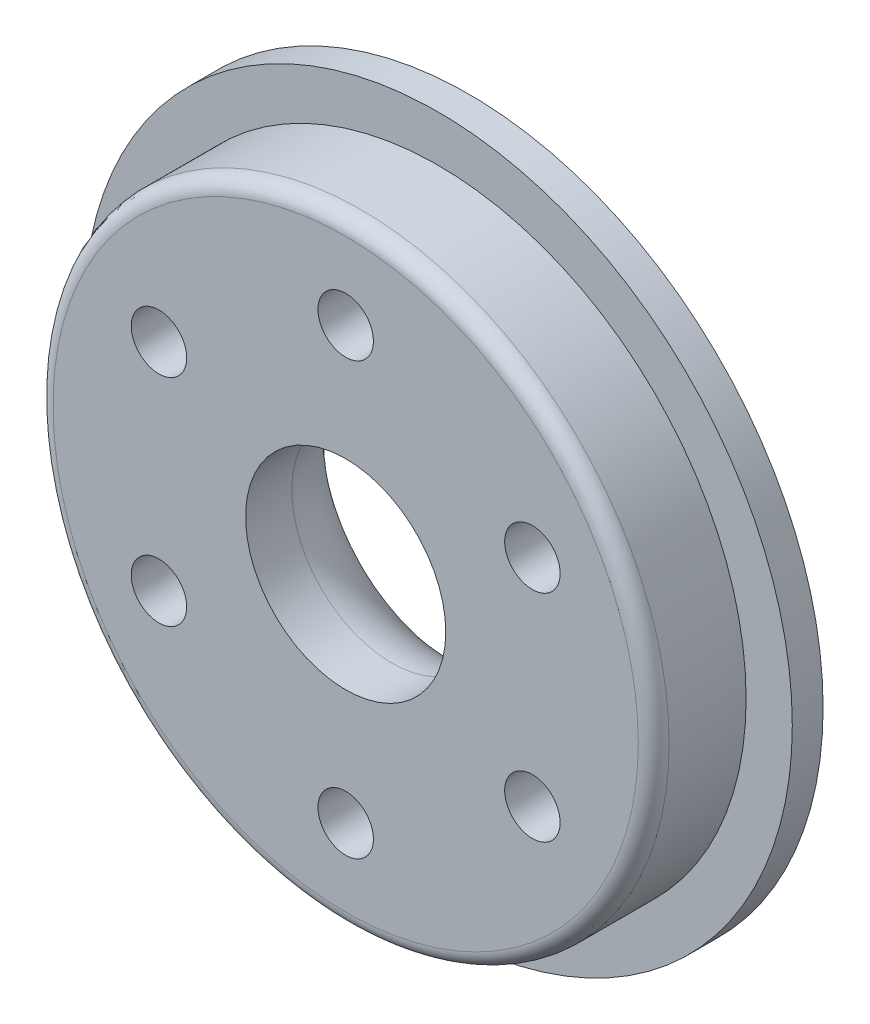
from build123d import *

# Parameters (mm, degrees)
SKETCH_1_R          = 23
EXTRUDE_1_DEPTH     = 2
SKETCH_2_R          = 20
EXTRUDE_2_DEPTH     = 6
SKETCH_3_R          = 1.8
CUT_EXTRUDE_1_DEPTH = 34.496268449
SKETCH_4_R          = 10
CUT_EXTRUDE_2_DEPTH = 34.496268449
FILLET_1_R          = 1
CUT_EXTRUDE_5_DEPTH = 2.8
EXTRUDE_START       = -11
SKETCH_9_R          = 10
SKETCH_9_R_2        = 6.5
EXTRUDE_3_DEPTH     = 11
SKETCH_10_R         = 10
SKETCH_10_R_2       = 8.5
CUT_EXTRUDE_6_DEPTH = 3
FILLET_3_R          = 1.5
FILLET_4_R          = 5
SKETCH_11_R         = 8.5
CUT_EXTRUDE_7_DEPTH = 34.496268473


with BuildPart() as part:
    # 草图1 → 凸台-拉伸1 (new body)
    with BuildSketch(Plane.XY):
        Circle(SKETCH_1_R)
    extrude(amount=EXTRUDE_1_DEPTH)

    # 草图2 → 凸台-拉伸2 (add)
    with BuildSketch(Plane.XY.offset(2)):
        Circle(SKETCH_2_R)
    extrude(amount=EXTRUDE_2_DEPTH)

    # 草图3 → 切除-拉伸1 (cut, through all)
    with BuildSketch(Plane.XY.offset(8)):
        with Locations((0, 14)):
            Circle(SKETCH_3_R)
        with Locations((12.124355653, 7)):
            Circle(SKETCH_3_R)
        with Locations((12.124355653, -7)):
            Circle(SKETCH_3_R)
        with Locations((0, -14)):
            Circle(SKETCH_3_R)
        with Locations((-12.124355653, -7)):
            Circle(SKETCH_3_R)
        with Locations((-12.124355653, 7)):
            Circle(SKETCH_3_R)
    extrude(amount=-CUT_EXTRUDE_1_DEPTH, mode=Mode.SUBTRACT)

    # 草图4 → 切除-拉伸2 (cut, through all)
    with BuildSketch(Plane.XY.offset(8)):
        Circle(SKETCH_4_R)
    extrude(amount=-CUT_EXTRUDE_2_DEPTH, mode=Mode.SUBTRACT)

    # 圆角1
    fillet_1_edges = [part.edges().sort_by_distance(p)[0] for p in [
        (-20, 0, 8),
    ]]
    fillet(fillet_1_edges, radius=FILLET_1_R)

    # 草图8 → 切除-拉伸5 (cut)
    with BuildSketch(Plane(origin=(0, 0, 0), x_dir=(-1, 0, 0), z_dir=(0, 0, -1))):
        Polygon((-10.507774899, 9.8), (-13.740936407, 9.8), (-15.35751716, 7), (-13.740936407, 4.2), (-10.507774899, 4.2), (-8.891194146, 7), align=None)
        Polygon((3.233161507, 14), (1.616580754, 16.8), (-1.616580754, 16.8), (-3.233161507, 14), (-1.616580754, 11.2), (1.616580754, 11.2), align=None)
        Polygon((13.740936407, 4.2), (15.35751716, 7), (13.740936407, 9.8), (10.507774899, 9.8), (8.891194146, 7), (10.507774899, 4.2), align=None)
        Polygon((10.507774899, -9.8), (13.740936407, -9.8), (15.35751716, -7), (13.740936407, -4.2), (10.507774899, -4.2), (8.891194146, -7), align=None)
        Polygon((-3.233161507, -14), (-1.616580754, -16.8), (1.616580754, -16.8), (3.233161507, -14), (1.616580754, -11.2), (-1.616580754, -11.2), align=None)
        Polygon((-13.740936407, -4.2), (-15.35751716, -7), (-13.740936407, -9.8), (-10.507774899, -9.8), (-8.891194146, -7), (-10.507774899, -4.2), align=None)
    extrude(amount=-CUT_EXTRUDE_5_DEPTH, mode=Mode.SUBTRACT)

    # 草图9 → 凸台-拉伸3 (add)
    with BuildSketch(Plane(origin=(0, 0, 0), x_dir=(-1, 0, 0), z_dir=(0, 0, -1)).offset(EXTRUDE_START)):
        Circle(SKETCH_9_R)
        Circle(SKETCH_9_R_2, mode=Mode.SUBTRACT)
    extrude(amount=EXTRUDE_3_DEPTH)

    # 草图10 → 切除-拉伸6 (cut)
    with BuildSketch(Plane.XY.offset(11)):
        Circle(SKETCH_10_R)
        Circle(SKETCH_10_R_2, mode=Mode.SUBTRACT)
    extrude(amount=-CUT_EXTRUDE_6_DEPTH, mode=Mode.SUBTRACT)

    # 圆角3
    fillet_3_edges = [part.edges().sort_by_distance(p)[0] for p in [
        (-8.5, 0, 11),
    ]]
    fillet(fillet_3_edges, radius=FILLET_3_R)

    # 圆角4
    # the kernel refuses this fillet: 5 mm, written as the material it takes off along each edge
    with BuildSketch(Plane(origin=(0, 0, 0), x_dir=(-1, 0, 0), z_dir=(0, -1, 0))) as fillet_4_piece_1:
        with BuildLine():
            CenterArc((6.5 + FILLET_4_R, -FILLET_4_R), FILLET_4_R, 90, 90)
            Line((6.5 + FILLET_4_R, 0), (6.5, 0))
            Line((6.5, 0), (6.5, -FILLET_4_R))
        make_face()
    revolve(axis=Axis((0, 0, 0), (0, 0, -1)), mode=Mode.SUBTRACT)

    # 草图11 → 切除-拉伸7 (cut, through all)
    with BuildSketch(Plane.XY.offset(8)):
        Circle(SKETCH_11_R)
    extrude(amount=CUT_EXTRUDE_7_DEPTH, mode=Mode.SUBTRACT)


solid = part.part
